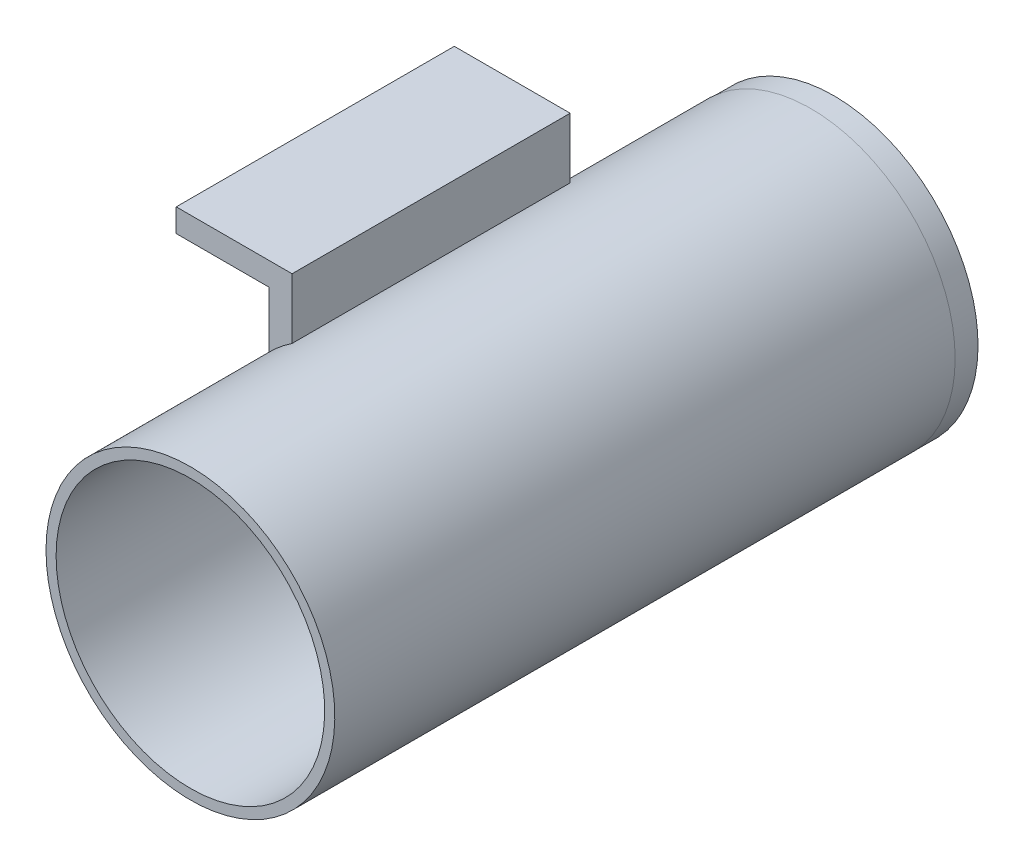
from build123d import *

# Parameters (mm, degrees)
BOSS_EXTRUDE1_DEPTH      = 38.1
BOSS_EXTRUDE2_DEPTH      = 22
BOSS_EXTRUDE2_DEPTH_BACK = 63
SKETCH2_R                = 19.784587186
SKETCH2_R_2              = 18.4
SKETCH3_R                = 19.748971086
BOSS_EXTRUDE3_DEPTH      = 3.175
SKETCH4_W                = 2.524062781
SKETCH4_H                = 10.768852164
CUT_EXTRUDE1_DEPTH       = 3.175


with BuildPart() as part:
    # Sketch1 → Boss-Extrude1 (new body)
    with BuildSketch(Plane.XY):
        Polygon((-6.637006615, 11.87570212), (-22.512006615, 11.87570212), (-22.512006615, 8.70070212), (-9.812006615, 8.70070212), (-9.812006615, 0.87570212), (-6.637006615, 0.87570212), align=None)
    extrude(amount=BOSS_EXTRUDE1_DEPTH)

    # Sketch2 → Boss-Extrude2 (add, two sides: drawn at the far end of the back side and taken through both)
    with BuildSketch(Plane(origin=(0, 0, 0), x_dir=(-1, 0, 0), z_dir=(0, 0, -1)).offset(-BOSS_EXTRUDE2_DEPTH_BACK)):
        with Locations((-4.329778131, -12.861954284)):
            Circle(SKETCH2_R)
        with Locations((-4.329778131, -12.861954284)):
            Circle(SKETCH2_R_2, mode=Mode.SUBTRACT)
    extrude(amount=BOSS_EXTRUDE2_DEPTH + BOSS_EXTRUDE2_DEPTH_BACK)

    # Sketch3 → Boss-Extrude3 (add)
    with BuildSketch(Plane(origin=(0, 0, -22), x_dir=(-1, 0, 0), z_dir=(0, 0, -1))):
        with Locations((-4.325565627, -12.897320389)):
            Circle(SKETCH3_R)
    extrude(amount=BOSS_EXTRUDE3_DEPTH)

    # Sketch4 → Cut-Extrude1 (cut)
    with BuildSketch(Plane(origin=(0, 0, -25.175), x_dir=(-1, 0, 0), z_dir=(0, 0, -1))):
        with Locations((-11.516921536, -24.461826694)):
            Rectangle(SKETCH4_W, SKETCH4_H)
    extrude(amount=-CUT_EXTRUDE1_DEPTH, mode=Mode.SUBTRACT)


solid = part.part
